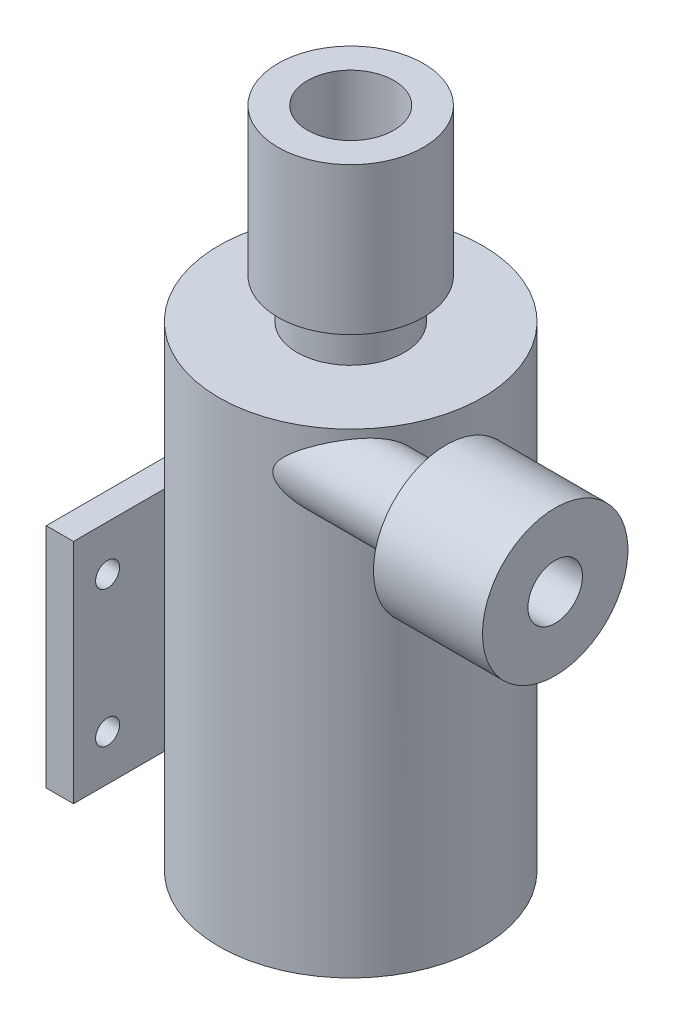
from build123d import *

# Parameters (mm, degrees)
SKETCH1_R           = 18.415
BOSS_EXTRUDE1_DEPTH = 66.421
SKETCH2_R           = 7.493
BOSS_EXTRUDE2_DEPTH = 5.588
SKETCH3_R           = 10.16
SKETCH3_R_2         = 6.0325
BOSS_EXTRUDE3_DEPTH = 20.574
SKETCH4_R           = 5.207
BOSS_EXTRUDE4_DEPTH = 25.4
SKETCH5_R           = 10.16
SKETCH5_R_2         = 3.81
BOSS_EXTRUDE5_DEPTH = 15.24
BOSS_EXTRUDE6_START = -20.32
SKETCH6_W           = 44.45
SKETCH6_H           = 31.75
SKETCH6_R           = 1.6764
BOSS_EXTRUDE6_DEPTH = 3.81


with BuildPart() as part:
    # Sketch1 → Boss-Extrude1 (new body)
    with BuildSketch(Plane(origin=(0, 0, 0), x_dir=(1, 0, 0), z_dir=(0, 1, 0))):
        Circle(SKETCH1_R)
    extrude(amount=BOSS_EXTRUDE1_DEPTH)

    # Sketch2 → Boss-Extrude2 (add)
    with BuildSketch(Plane(origin=(0, 66.421, 0), x_dir=(1, 0, 0), z_dir=(0, 1, 0))):
        Circle(SKETCH2_R)
    extrude(amount=BOSS_EXTRUDE2_DEPTH)

    # Sketch3 → Boss-Extrude3 (add)
    with BuildSketch(Plane(origin=(0, 72.009, 0), x_dir=(1, 0, 0), z_dir=(0, 1, 0))):
        Circle(SKETCH3_R)
        Circle(SKETCH3_R_2, mode=Mode.SUBTRACT)
    extrude(amount=BOSS_EXTRUDE3_DEPTH)

    # Sketch4 → Boss-Extrude4 (add)
    with BuildSketch(Plane(origin=(0, 0, 0), x_dir=(0, 0, -1), z_dir=(1, 0, 0))):
        with Locations((-12.065, 60.071)):
            Circle(SKETCH4_R)
    extrude(amount=BOSS_EXTRUDE4_DEPTH)

    # Sketch5 → Boss-Extrude5 (add)
    with BuildSketch(Plane(origin=(25.4, 0, 0), x_dir=(0, 0, -1), z_dir=(1, 0, 0))):
        with Locations((-12.065, 60.071)):
            Circle(SKETCH5_R)
        with Locations((-12.065, 60.071)):
            Circle(SKETCH5_R_2, mode=Mode.SUBTRACT)
    extrude(amount=BOSS_EXTRUDE5_DEPTH)

    # Sketch6 → Boss-Extrude6 (add)
    with BuildSketch(Plane(origin=(0, 0, 0), x_dir=(0, 0, -1), z_dir=(1, 0, 0)).offset(BOSS_EXTRUDE6_START)):
        with Locations((0, 26.797)):
            Rectangle(SKETCH6_W, SKETCH6_H)
        with Locations((-17.4625, 36.322)):
            Circle(SKETCH6_R, mode=Mode.SUBTRACT)
        with Locations((17.4625, 36.322)):
            Circle(SKETCH6_R, mode=Mode.SUBTRACT)
        with Locations((17.4625, 17.272)):
            Circle(SKETCH6_R, mode=Mode.SUBTRACT)
        with Locations((-17.4625, 17.272)):
            Circle(SKETCH6_R, mode=Mode.SUBTRACT)
    extrude(amount=BOSS_EXTRUDE6_DEPTH)


solid = part.part
